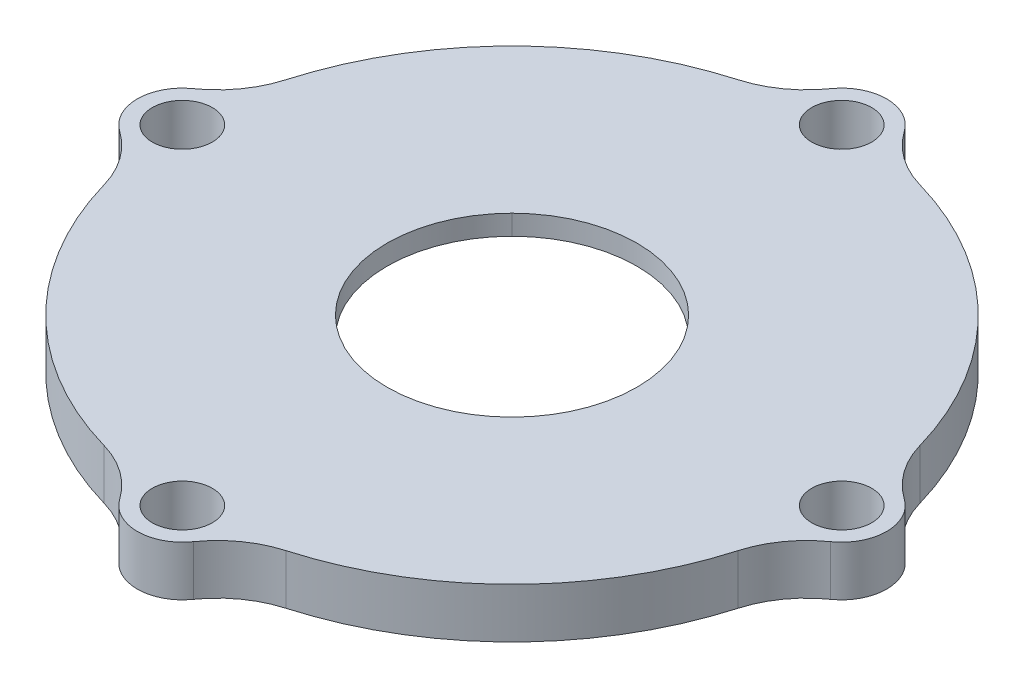
from build123d import *

# Parameters (mm, degrees)
BOSS_EXTRUDE1_OUTLINE_W = 75
BOSS_EXTRUDE1_OUTLINE_H = 75
BOSS_EXTRUDE1_OUTLINE_R = 3
BOSS_EXTRUDE1_DEPTH     = 5
SKETCH2_R               = 27.75
CUT_EXTRUDE1_DEPTH      = 3
SKETCH3_OUTSIDE_W       = 98.236
SKETCH3_OUTSIDE_H       = 98.236
CUT_EXTRUDE5_DEPTH      = 5


# Read off the part's stored shape, not the designer's step: Boss-Extrude1
with BuildPart() as part:
    # Boss-Extrude1 outline → Boss-Extrude1 (new body)
    with BuildSketch(Plane(origin=(0, 0, 0), x_dir=(1, 0, 0), z_dir=(0, 1, 0))):
        Rectangle(BOSS_EXTRUDE1_OUTLINE_W, BOSS_EXTRUDE1_OUTLINE_H)
        with Locations((0.001, -33.001)):
            Circle(BOSS_EXTRUDE1_OUTLINE_R, mode=Mode.SUBTRACT)
        with Locations((-33, 0)):
            Circle(BOSS_EXTRUDE1_OUTLINE_R, mode=Mode.SUBTRACT)
        with BuildLine():
            ThreePointArc((8.840334751, 8.839334751), (12.502, 0), (8.840334751, -8.839334751))
            ThreePointArc((8.840334751, -8.839334751), (0.001, -12.501), (-8.838334751, -8.839334751))
            ThreePointArc((-8.838334751, -8.839334751), (-12.5, 0), (-8.838334751, 8.839334751))
            ThreePointArc((-8.838334751, 8.839334751), (0.001, 12.501), (8.840334751, 8.839334751))
        make_face(mode=Mode.SUBTRACT)
        with Locations((33.002, 0)):
            Circle(BOSS_EXTRUDE1_OUTLINE_R, mode=Mode.SUBTRACT)
        with Locations((0.001, 33.001)):
            Circle(BOSS_EXTRUDE1_OUTLINE_R, mode=Mode.SUBTRACT)
    extrude(amount=BOSS_EXTRUDE1_DEPTH)

    # Sketch2 → Cut-Extrude1 (cut)
    with BuildSketch(Plane.XZ):
        with Locations(Location((0, 0, 0), (0, 0, 270))):
            Circle(SKETCH2_R)
    extrude(amount=-CUT_EXTRUDE1_DEPTH, mode=Mode.SUBTRACT)

    # Sketch3 outside → Cut-Extrude5 (cut)
    with BuildSketch(Plane.XZ):
        Rectangle(SKETCH3_OUTSIDE_W, SKETCH3_OUTSIDE_H)
        with BuildLine():
            ThreePointArc((-31.718023256, -9.10862233), (-23.334523779, -23.334523779), (-9.10862233, -31.718023256))
            ThreePointArc((-9.10862233, -31.718023256), (-6.064515675, -33.186440594), (-3.683424077, -35.585031348))
            ThreePointArc((-3.683424077, -35.585031348), (0, -37.5), (3.683424077, -35.585031348))
            ThreePointArc((3.683424077, -35.585031348), (6.064515675, -33.186440594), (9.10862233, -31.718023256))
            ThreePointArc((9.10862233, -31.718023256), (23.334523779, -23.334523779), (31.718023256, -9.10862233))
            ThreePointArc((31.718023256, -9.10862233), (33.186440594, -6.064515675), (35.585031348, -3.683424077))
            ThreePointArc((35.585031348, -3.683424077), (37.5, 0), (35.585031348, 3.683424077))
            ThreePointArc((35.585031348, 3.683424077), (33.186440594, 6.064515675), (31.718023256, 9.10862233))
            ThreePointArc((31.718023256, 9.10862233), (23.334523779, 23.334523779), (9.10862233, 31.718023256))
            ThreePointArc((9.10862233, 31.718023256), (6.064515675, 33.186440594), (3.683424077, 35.585031348))
            ThreePointArc((3.683424077, 35.585031348), (0, 37.5), (-3.683424077, 35.585031348))
            ThreePointArc((-3.683424077, 35.585031348), (-6.064515675, 33.186440594), (-9.10862233, 31.718023256))
            ThreePointArc((-9.10862233, 31.718023256), (-23.334523779, 23.334523779), (-31.718023256, 9.10862233))
            ThreePointArc((-31.718023256, 9.10862233), (-33.186440594, 6.064515675), (-35.585031348, 3.683424077))
            ThreePointArc((-35.585031348, 3.683424077), (-37.5, 0), (-35.585031348, -3.683424077))
            ThreePointArc((-35.585031348, -3.683424077), (-33.186440594, -6.064515675), (-31.718023256, -9.10862233))
        make_face(mode=Mode.SUBTRACT)
    extrude(amount=-CUT_EXTRUDE5_DEPTH, mode=Mode.SUBTRACT)


solid = part.part
